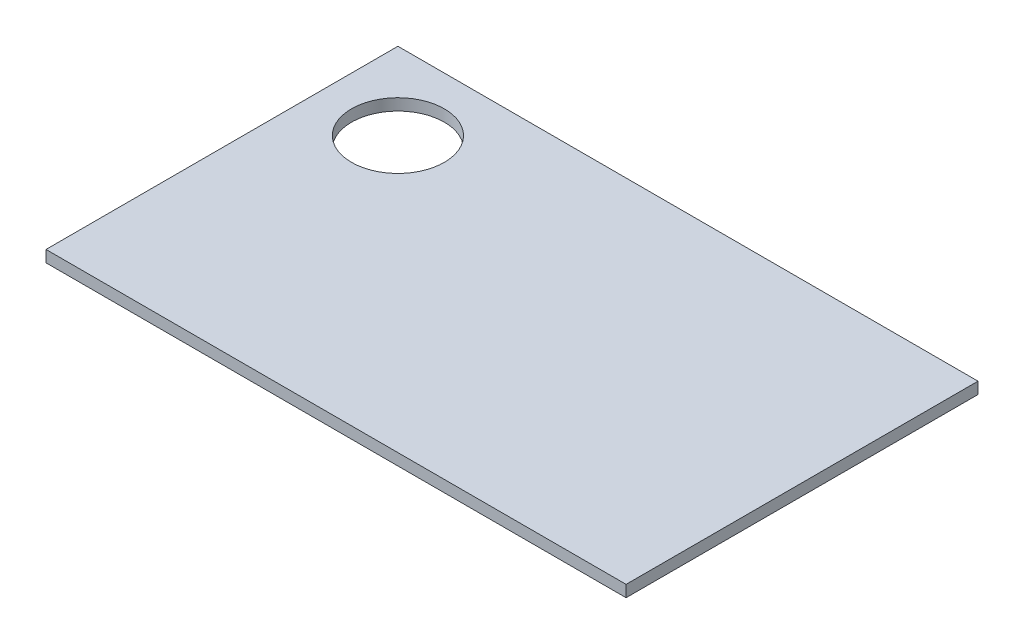
from build123d import *

# Parameters (mm, degrees)
SKETCH3_W           = 952.5
SKETCH3_H           = 577.85
BOSS_EXTRUDE2_DEPTH = 19.05
SKETCH4_R           = 76.2
CUT_EXTRUDE1_DEPTH  = 563.360531599


with BuildPart() as part:
    # Sketch3 → Boss-Extrude2 (new body)
    with BuildSketch(Plane(origin=(0, 711.2, 0), x_dir=(1, 0, 0), z_dir=(0, 1, 0))):
        with Locations((0, 9.525)):
            Rectangle(SKETCH3_W, SKETCH3_H)
    extrude(amount=-BOSS_EXTRUDE2_DEPTH)

    # Sketch4 → Cut-Extrude1 (cut, through all)
    with BuildSketch(Plane(origin=(0, 711.2, 0), x_dir=(1, 0, 0), z_dir=(0, 1, 0))):
        with Locations((-349.25, 171.45)):
            Circle(SKETCH4_R)
    extrude(amount=-CUT_EXTRUDE1_DEPTH, mode=Mode.SUBTRACT)


solid = part.part
